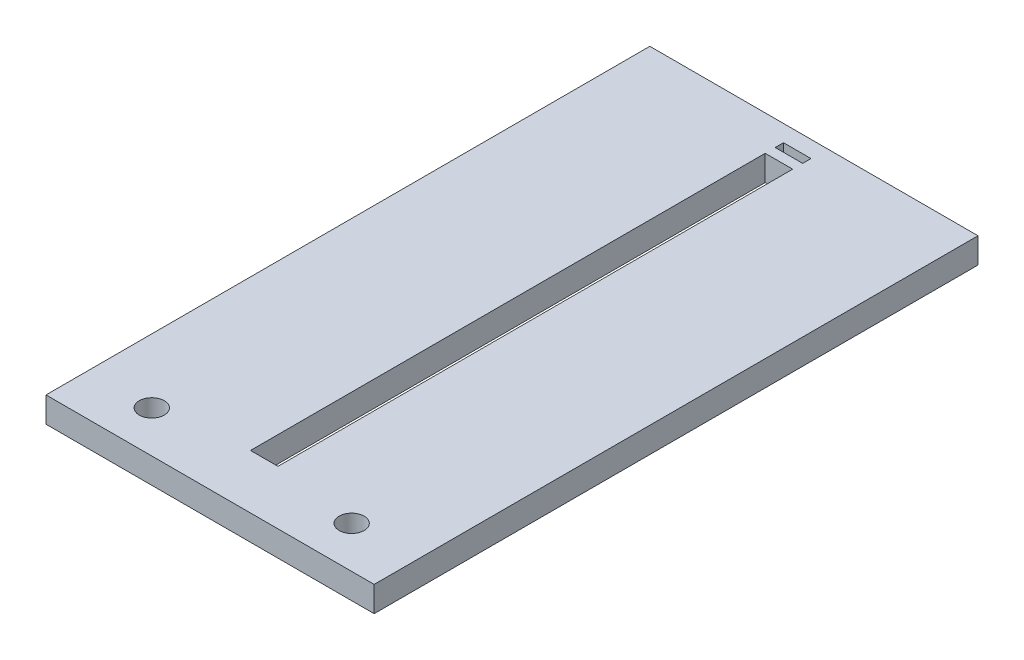
from build123d import *

# Parameters (mm, degrees)
SKETCH1_W           = 39.4
SKETCH1_H           = 72.5
BOSS_EXTRUDE1_DEPTH = 3.05
SKETCH4_W           = 3.3
SKETCH4_H           = 1
SKETCH4_H_2         = 61.8
CUT_EXTRUDE1_DEPTH  = 76.190707538
SKETCH7_R           = 1.5
CUT_EXTRUDE4_DEPTH  = 76.190707538


with BuildPart() as part:
    # Sketch1 → Boss-Extrude1 (new body)
    with BuildSketch(Plane(origin=(0, 0, 0), x_dir=(1, 0, 0), z_dir=(0, 1, 0))):
        with Locations((0, 36.25)):
            Rectangle(SKETCH1_W, SKETCH1_H)
    extrude(amount=BOSS_EXTRUDE1_DEPTH)

    # Sketch4 → Cut-Extrude1 (cut, through all)
    with BuildSketch(Plane(origin=(0, 3.05, 0), x_dir=(1, 0, 0), z_dir=(0, 1, 0))):
        with Locations((0, 70)):
            Rectangle(SKETCH4_W, SKETCH4_H)
        with Locations((0, 37.4)):
            Rectangle(SKETCH4_W, SKETCH4_H_2)
    extrude(amount=-CUT_EXTRUDE1_DEPTH, mode=Mode.SUBTRACT)

    # Sketch7 → Cut-Extrude4 (cut, through all)
    with BuildSketch(Plane(origin=(0, 3.05, 0), x_dir=(1, 0, 0), z_dir=(0, 1, 0))):
        with Locations((-12, 5)):
            Circle(SKETCH7_R)
        with Locations((12, 5)):
            Circle(SKETCH7_R)
    extrude(amount=-CUT_EXTRUDE4_DEPTH, mode=Mode.SUBTRACT)


solid = part.part
